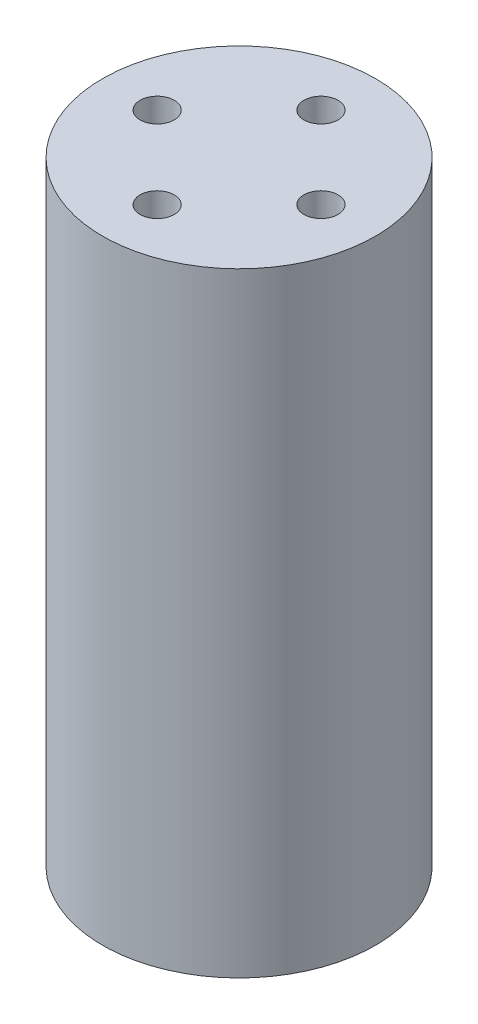
from build123d import *

# Parameters (mm, degrees)
SKETCH_1_R      = 10
EXTRUDE_1_DEPTH = 45
M3X0_51_D       = 2.5
M3X0_51_DEPTH   = 8.5
M3X0_51_TIP     = 0.751075774
M3X0_52_D       = 2.5
M3X0_52_DEPTH   = 8.5
M3X0_52_TIP     = 0.751075774


with BuildPart() as part:
    # Эскиз1 → Бобышка-Вытянуть1 (new body)
    with BuildSketch(Plane(origin=(0, 0, 0), x_dir=(1, 0, 0), z_dir=(0, 1, 0))):
        Circle(SKETCH_1_R)
    extrude(amount=EXTRUDE_1_DEPTH)

    # Отверстие обработанное метчиком M3x0.51
    with Locations(Plane(origin=(0, 45, 0), x_dir=(1, 0, 0), z_dir=(0, 1, 0))):
        with Locations((0, 6), (-6, 0), (0, -6), (6, 0)):
            Hole(M3X0_51_D / 2, depth=M3X0_51_DEPTH)
            with Locations((0, 0, -(M3X0_51_DEPTH + M3X0_51_TIP / 2))):  # 118° drill point
                Cone(0, M3X0_51_D / 2, M3X0_51_TIP, mode=Mode.SUBTRACT)

    # Отверстие обработанное метчиком M3x0.52
    with Locations(Plane(origin=(0, 0, 0), x_dir=(-1, 0, 0), z_dir=(0, -1, 0))):
        with Locations((0, 6), (-6, 0), (0, -6), (6, 0)):
            Hole(M3X0_52_D / 2, depth=M3X0_52_DEPTH)
            with Locations((0, 0, -(M3X0_52_DEPTH + M3X0_52_TIP / 2))):  # 118° drill point
                Cone(0, M3X0_52_D / 2, M3X0_52_TIP, mode=Mode.SUBTRACT)


solid = part.part
